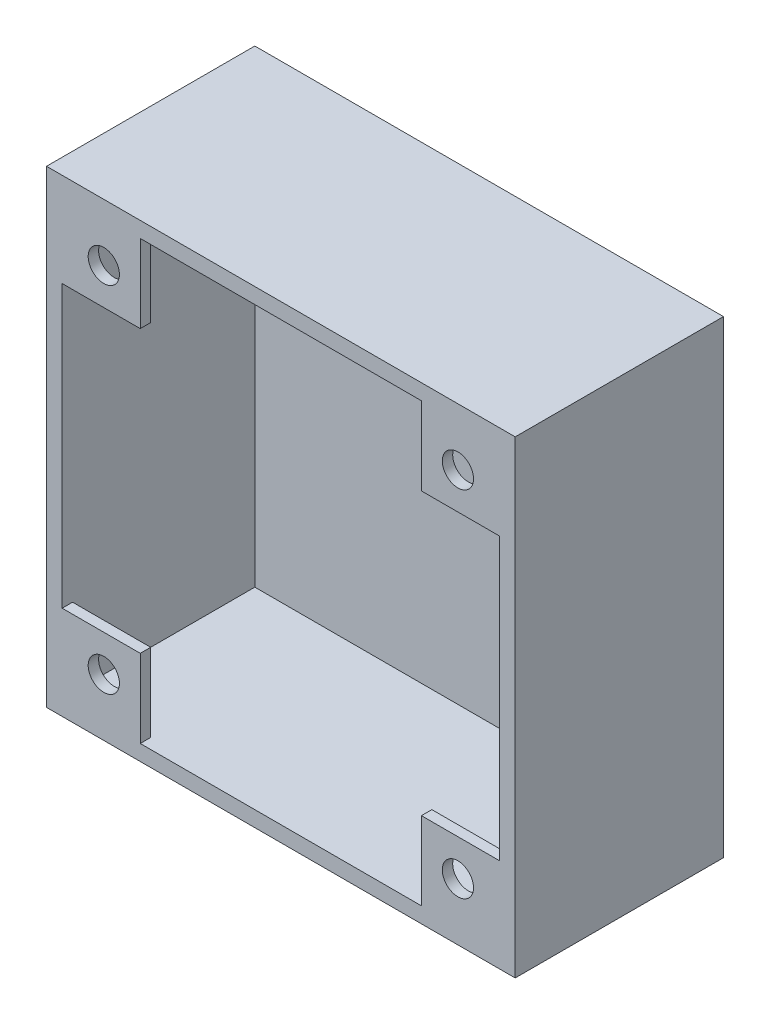
from build123d import *

# Parameters (mm, degrees)
SKETCH_1_W          = 90
SKETCH_1_H          = 90
EXTRUDE_1_DEPTH     = 40
SHELL_1_T           = -3
SKETCH_2_W          = 15
SKETCH_2_H          = 15
EXTRUDE_2_DEPTH     = 2
CUT_EXTRUDE_1_REACH = 77.166
SKETCH_3_R          = 3


with BuildPart() as part:
    # 草图1 → 凸台-拉伸1 (new body)
    with BuildSketch(Plane.XY):
        Rectangle(SKETCH_1_W, SKETCH_1_H)
    extrude(amount=EXTRUDE_1_DEPTH)

    # 抽壳1
    shell_1_openings = [part.faces().sort_by_distance(p)[0] for p in [
        (0, 0, 40),
    ]]
    offset(amount=SHELL_1_T, openings=shell_1_openings, kind=Kind.INTERSECTION)

    # 草图2 → 凸台-拉伸2 (add)
    with BuildSketch(Plane.XY.offset(40)):
        with Locations((-34.5, 34.5)):
            Rectangle(SKETCH_2_W, SKETCH_2_H)
        with Locations((34.5, 34.5)):
            Rectangle(SKETCH_2_W, SKETCH_2_H)
        with Locations((34.5, -34.5)):
            Rectangle(SKETCH_2_W, SKETCH_2_H)
        with Locations((-34.5, -34.5)):
            Rectangle(SKETCH_2_W, SKETCH_2_H)
    extrude(amount=-EXTRUDE_2_DEPTH)

    # 草图3 → 切除-拉伸1 (cut, up to next)
    with BuildSketch(Plane.XY.offset(40), mode=Mode.PRIVATE) as cut_extrude_1_sk1:
        with Locations((-34, 34)):
            Circle(SKETCH_3_R)
    cut_extrude_1_tool1 = extrude(cut_extrude_1_sk1.sketch, amount=-CUT_EXTRUDE_1_REACH, mode=Mode.PRIVATE) & part.part
    # 草图3 → 切除-拉伸1 (cut, up to next)
    with BuildSketch(Plane.XY.offset(40), mode=Mode.PRIVATE) as cut_extrude_1_sk2:
        with Locations((34, 34)):
            Circle(SKETCH_3_R)
    cut_extrude_1_tool2 = extrude(cut_extrude_1_sk2.sketch, amount=-CUT_EXTRUDE_1_REACH, mode=Mode.PRIVATE) & part.part
    # 草图3 → 切除-拉伸1 (cut, up to next)
    with BuildSketch(Plane.XY.offset(40), mode=Mode.PRIVATE) as cut_extrude_1_sk3:
        with Locations((34, -34)):
            Circle(SKETCH_3_R)
    cut_extrude_1_tool3 = extrude(cut_extrude_1_sk3.sketch, amount=-CUT_EXTRUDE_1_REACH, mode=Mode.PRIVATE) & part.part
    # 草图3 → 切除-拉伸1 (cut, up to next)
    with BuildSketch(Plane.XY.offset(40), mode=Mode.PRIVATE) as cut_extrude_1_sk4:
        with Locations((-34, -34)):
            Circle(SKETCH_3_R)
    cut_extrude_1_tool4 = extrude(cut_extrude_1_sk4.sketch, amount=-CUT_EXTRUDE_1_REACH, mode=Mode.PRIVATE) & part.part
    add(cut_extrude_1_tool1.solids().sort_by_distance((-34, 34, 40))[0], mode=Mode.SUBTRACT)
    add(cut_extrude_1_tool2.solids().sort_by_distance((34, 34, 40))[0], mode=Mode.SUBTRACT)
    add(cut_extrude_1_tool3.solids().sort_by_distance((34, -34, 40))[0], mode=Mode.SUBTRACT)
    add(cut_extrude_1_tool4.solids().sort_by_distance((-34, -34, 40))[0], mode=Mode.SUBTRACT)


solid = part.part
